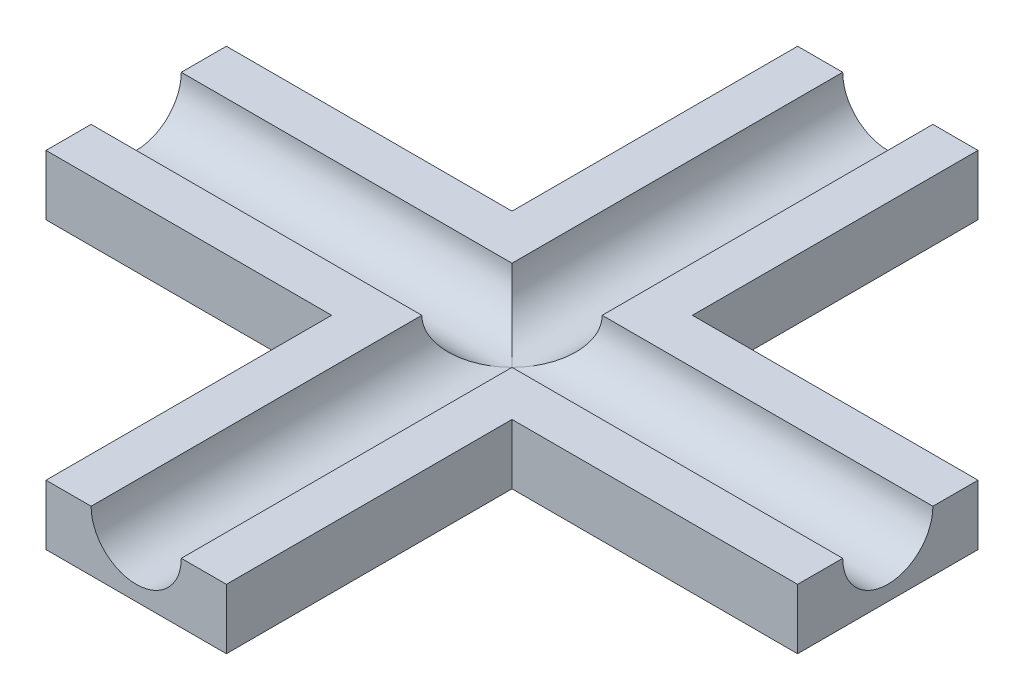
from build123d import *

# Parameters (mm, degrees)
SKETCH1_W           = 50
SKETCH1_H           = 50
BOSS_EXTRUDE1_DEPTH = 10
CUT_EXTRUDE1_REACH  = 58.789
SKETCH2_R           = 3
CIRPATTERN1_COUNT   = 4
SKETCH3_W           = 10
SKETCH3_H           = 10
CUT_EXTRUDE2_DEPTH  = 1
CUT_EXTRUDE3_REACH  = 38.742
SKETCH5_W           = 19
SKETCH5_H           = 19
SKETCH6_W           = 60
SKETCH6_H           = 60
CUT_EXTRUDE4_DEPTH  = 6


with BuildPart() as part:
    # Sketch1 → Boss-Extrude1 (new body)
    with BuildSketch(Plane(origin=(0, 0, 0), x_dir=(1, 0, 0), z_dir=(0, 1, 0))):
        Rectangle(SKETCH1_W, SKETCH1_H)
    extrude(amount=BOSS_EXTRUDE1_DEPTH)

    # Sketch2 → Cut-Extrude1 (cut, up to next)
    with BuildSketch(Plane(origin=(25, 0, 0), x_dir=(0, 0, -1), z_dir=(1, 0, 0)), mode=Mode.PRIVATE) as cut_extrude1_sk1:
        with Locations((0, 4)):
            Circle(SKETCH2_R)
    cut_extrude1_tool1 = extrude(cut_extrude1_sk1.sketch, amount=-CUT_EXTRUDE1_REACH, mode=Mode.PRIVATE) & part.part
    cut_extrude1 = cut_extrude1_tool1.solids().sort_by_distance((25, 4, 0))[0]
    add(cut_extrude1, mode=Mode.SUBTRACT)

    # CirPattern1: Cut-Extrude1 ×4 about axis
    cirpattern1_axis = Axis((0, 21, 0), (0, -1, 0))
    for i in range(1, CIRPATTERN1_COUNT):
        add(cut_extrude1.rotate(cirpattern1_axis, i * 360 / CIRPATTERN1_COUNT), mode=Mode.SUBTRACT)

    # Sketch3 → Cut-Extrude2 (cut)
    with BuildSketch(Plane(origin=(0, 10, 0), x_dir=(1, 0, 0), z_dir=(0, 1, 0))):
        with Locations((20, 0)):
            Rectangle(SKETCH3_W, SKETCH3_H)
        with Locations((0, -20)):
            Rectangle(SKETCH3_W, SKETCH3_H)
    extrude(amount=-CUT_EXTRUDE2_DEPTH, mode=Mode.SUBTRACT)

    # Sketch5 → Cut-Extrude3 (cut, up to next)
    with BuildSketch(Plane(origin=(0, 10, 0), x_dir=(1, 0, 0), z_dir=(0, 1, 0)), mode=Mode.PRIVATE) as cut_extrude3_sk1:
        with Locations((-15.5, 15.5)):
            Rectangle(SKETCH5_W, SKETCH5_H)
    cut_extrude3_tool1 = extrude(cut_extrude3_sk1.sketch, amount=-CUT_EXTRUDE3_REACH, mode=Mode.PRIVATE) & part.part
    # Sketch5 → Cut-Extrude3 (cut, up to next)
    with BuildSketch(Plane(origin=(0, 10, 0), x_dir=(1, 0, 0), z_dir=(0, 1, 0)), mode=Mode.PRIVATE) as cut_extrude3_sk2:
        with Locations((15.5, 15.5)):
            Rectangle(SKETCH5_W, SKETCH5_H)
    cut_extrude3_tool2 = extrude(cut_extrude3_sk2.sketch, amount=-CUT_EXTRUDE3_REACH, mode=Mode.PRIVATE) & part.part
    # Sketch5 → Cut-Extrude3 (cut, up to next)
    with BuildSketch(Plane(origin=(0, 10, 0), x_dir=(1, 0, 0), z_dir=(0, 1, 0)), mode=Mode.PRIVATE) as cut_extrude3_sk3:
        with Locations((-15.5, -15.5)):
            Rectangle(SKETCH5_W, SKETCH5_H)
    cut_extrude3_tool3 = extrude(cut_extrude3_sk3.sketch, amount=-CUT_EXTRUDE3_REACH, mode=Mode.PRIVATE) & part.part
    # Sketch5 → Cut-Extrude3 (cut, up to next)
    with BuildSketch(Plane(origin=(0, 10, 0), x_dir=(1, 0, 0), z_dir=(0, 1, 0)), mode=Mode.PRIVATE) as cut_extrude3_sk4:
        with Locations((15.5, -15.5)):
            Rectangle(SKETCH5_W, SKETCH5_H)
    cut_extrude3_tool4 = extrude(cut_extrude3_sk4.sketch, amount=-CUT_EXTRUDE3_REACH, mode=Mode.PRIVATE) & part.part
    add(cut_extrude3_tool1.solids().sort_by_distance((-15.5, 10, -15.5))[0], mode=Mode.SUBTRACT)
    add(cut_extrude3_tool2.solids().sort_by_distance((15.5, 10, -15.5))[0], mode=Mode.SUBTRACT)
    add(cut_extrude3_tool3.solids().sort_by_distance((-15.5, 10, 15.5))[0], mode=Mode.SUBTRACT)
    add(cut_extrude3_tool4.solids().sort_by_distance((15.5, 10, 15.5))[0], mode=Mode.SUBTRACT)

    # Sketch6 → Cut-Extrude4 (cut)
    with BuildSketch(Plane(origin=(0, 10, 0), x_dir=(1, 0, 0), z_dir=(0, 1, 0))):
        Rectangle(SKETCH6_W, SKETCH6_H)
    extrude(amount=-CUT_EXTRUDE4_DEPTH, mode=Mode.SUBTRACT)


solid = part.part
